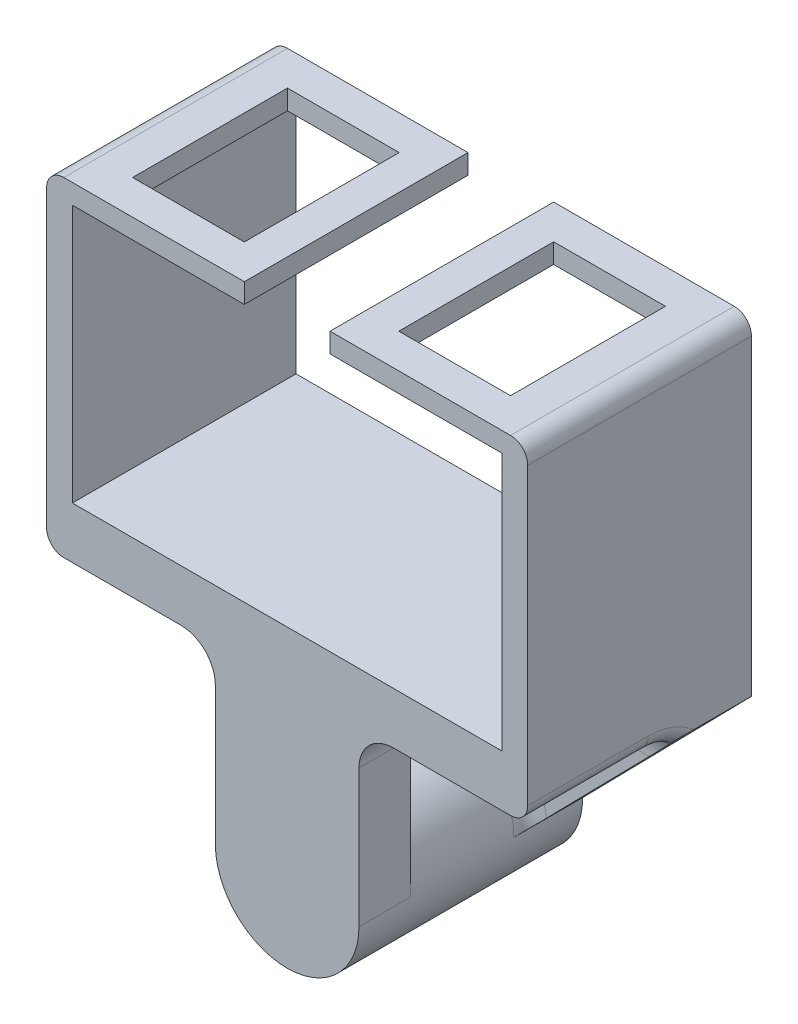
from build123d import *

# Parameters (mm, degrees)
SKETCH1_R             = 10.603707514
BOSS_EXTRUDE1_DEPTH   = 33.02
BOSS_EXTRUDE1_2_DEPTH = 33.02
BOSS_EXTRUDE3_DEPTH   = 7.62
FILLET1_R             = 7.62
FILLET2_START         = 15.24
FILLET2_2_DEPTH       = 18.76
FILLET2_START_2       = -1
FILLET2_3_DEPTH       = 18.231506659
FILLET3_R             = 2.54
SKETCH6_W             = 16.48968
SKETCH6_H             = 22.86
CUT_EXTRUDE1_DEPTH    = 2.905181288
SKETCH7_W             = 21.207415028
SKETCH7_H             = 25.4
BOSS_EXTRUDE4_DEPTH   = 7.62
FILLET4_R             = 5.08


with BuildPart() as part:
    # Sketch1 → Boss-Extrude1 (new body)
    with BuildSketch(Plane.XY):
        Circle(SKETCH1_R)
    extrude(amount=BOSS_EXTRUDE1_DEPTH)



with BuildPart() as body_2:
    # Sketch1 → Boss-Extrude1 2 (new body)
    with BuildSketch(Plane.XY):
        Polygon((-35.51428, 73.999781288), (-35.51428, 25.4), (35.51428, 25.4), (35.51428, 73.999781288), (6.3246, 73.999781288), (6.3246, 71.0946), (31.70428, 71.0946), (31.70428, 33.02), (-31.70428, 33.02), (-31.70428, 71.0946), (-6.3246, 71.0946), (-6.3246, 73.999781288), align=None)
    extrude(amount=BOSS_EXTRUDE1_2_DEPTH)


with BuildPart() as part_1:
    add(part.part)

    add(body_2.part)  # Boss-Extrude3 merges body 2
    # Sketch3 → Boss-Extrude3 (add)
    with BuildSketch(Plane(origin=(0, 0, 0), x_dir=(-1, 0, 0), z_dir=(0, 0, -1))):
        with BuildLine():
            Line((-10.603707514, 0), (-35.51428, 25.4))
            Line((-35.51428, 25.4), (35.51428, 25.4))
            Line((35.51428, 25.4), (10.603707514, 0))
            ThreePointArc((10.603707514, 0), (0, -10.603707514), (-10.603707514, 0))
        make_face()
    extrude(amount=-BOSS_EXTRUDE3_DEPTH)

    # Fillet1
    fillet1_edges = [part_1.edges().sort_by_distance(p)[0] for p in [
        (0, 25.4, 7.62),
    ]]
    fillet(fillet1_edges, radius=FILLET1_R)

    # Fillet2: read off the stored shape, not the designer's step
    # Fillet2 outline → Fillet2 (revolve, cut)
    with BuildSketch(Plane(origin=(0, 17.78, 15.24), x_dir=(0, 1, 0), z_dir=(0, 0, -1))):
        with BuildLine():
            ThreePointArc((10.16, -35.51428), (8.363948776, -34.770331224), (7.62, -32.97428))
            Line((7.62, -32.97428), (7.62, -35.51428))
            Line((7.62, -35.51428), (10.16, -35.51428))
        make_face()
        with BuildLine():
            Line((7.62, 35.51428), (7.62, 32.97428))
            ThreePointArc((7.62, 32.97428), (8.363948776, 34.770331224), (10.16, 35.51428))
            Line((10.16, 35.51428), (7.62, 35.51428))
        make_face()
    revolve(axis=Axis((0, 17.78, 15.24), (1, 0, 0)), mode=Mode.SUBTRACT)

    # Fillet2 2 outline → Fillet2 2 (cut)
    with BuildSketch(Plane.XY.offset(FILLET2_START)):
        with BuildLine():
            Line((-35.51428, 73.999781288), (-35.51428, 71.459781288))
            ThreePointArc((-35.51428, 71.459781288), (-34.770331224, 73.255832512), (-32.97428, 73.999781288))
            Line((-32.97428, 73.999781288), (-35.51428, 73.999781288))
        make_face()
        with BuildLine():
            ThreePointArc((32.97428, 73.999781288), (34.770331224, 73.255832512), (35.51428, 71.459781288))
            Line((35.51428, 71.459781288), (35.51428, 73.999781288))
            Line((35.51428, 73.999781288), (32.97428, 73.999781288))
        make_face()
        with BuildLine():
            ThreePointArc((35.51428, 27.94), (34.770331224, 26.143948776), (32.97428, 25.4))
            Line((32.97428, 25.4), (35.51428, 25.4))
            Line((35.51428, 25.4), (35.51428, 27.94))
        make_face()
        with BuildLine():
            ThreePointArc((-32.97428, 25.4), (-34.770331224, 26.143948776), (-35.51428, 27.94))
            Line((-35.51428, 27.94), (-35.51428, 25.4))
            Line((-35.51428, 25.4), (-32.97428, 25.4))
        make_face()
    extrude(amount=FILLET2_2_DEPTH, mode=Mode.SUBTRACT)

    # Fillet2 3 outline → Fillet2 3 (cut)
    with BuildSketch(Plane.XY.offset(FILLET2_START_2)):
        with BuildLine():
            Line((-35.51428, 73.999781288), (-35.51428, 71.459781288))
            ThreePointArc((-35.51428, 71.459781288), (-34.770331224, 73.255832512), (-32.97428, 73.999781288))
            Line((-32.97428, 73.999781288), (-35.51428, 73.999781288))
        make_face()
        with BuildLine():
            ThreePointArc((32.97428, 73.999781288), (34.770331224, 73.255832512), (35.51428, 71.459781288))
            Line((35.51428, 71.459781288), (35.51428, 73.999781288))
            Line((35.51428, 73.999781288), (32.97428, 73.999781288))
        make_face()
    extrude(amount=FILLET2_3_DEPTH, mode=Mode.SUBTRACT)

    # Fillet3
    # the kernel refuses this fillet: 2.54 mm, written as the material it adds along each edge
    with BuildSketch(Plane(origin=(0, 0, 7.62), x_dir=(-0.8254427651523181, -0.5644858204221742, 0), z_dir=(0.5644858204221742, -0.8254427651523181, 0))) as fillet3_piece_1_section:
        with BuildLine():
            CenterArc((10.603707514 + FILLET3_R, -FILLET3_R), FILLET3_R, 90, 90)
            Line((10.603707514 + FILLET3_R, 0), (10.603707514, 0))
            Line((10.603707514, 0), (10.603707514, -FILLET3_R))
        make_face()
    fillet3_piece_1 = revolve(axis=Axis((0, 0, 7.62), (0, 0, -1)), revolution_arc=248.733186756, mode=Mode.PRIVATE)
    fillet3_piece_1 = split(fillet3_piece_1, bisect_by=Plane(origin=(5.404998183, -5.300850355, 7.62), z_dir=(-0.713951821892461, 0.7001948271848599, 0)), keep=Keep.TOP, mode=Mode.PRIVATE)
    fillet3_piece_1 = split(fillet3_piece_1, bisect_by=Plane(origin=(-5.404998183, -5.300850355, 7.62), z_dir=(0.713951821892461, 0.7001948271848599, 0)), keep=Keep.TOP, mode=Mode.PRIVATE)
    add(fillet3_piece_1)

    # Sketch6 → Cut-Extrude1 (cut)
    with BuildSketch(Plane(origin=(0, 73.999781288, 0), x_dir=(1, 0, 0), z_dir=(0, 1, 0))):
        with Locations((-19.64944, -16.51)):
            Rectangle(SKETCH6_W, SKETCH6_H)
        with Locations((19.64944, -16.51)):
            Rectangle(SKETCH6_W, SKETCH6_H)
    extrude(amount=-CUT_EXTRUDE1_DEPTH, mode=Mode.SUBTRACT)

    # Sketch7 → Boss-Extrude4 (add)
    with BuildSketch(Plane.XY.offset(33.02)):
        with Locations((0, 12.7)):
            Rectangle(SKETCH7_W, SKETCH7_H)
    extrude(amount=-BOSS_EXTRUDE4_DEPTH)

    # Fillet4
    fillet4_edges = [part_1.edges().sort_by_distance(p)[0] for p in [
        (0, 25.4, 25.4),
        (-10.603707514, 25.4, 29.21),
        (10.603707514, 25.4, 29.21),
    ]]
    fillet(fillet4_edges, radius=FILLET4_R)


solid = part_1.part
